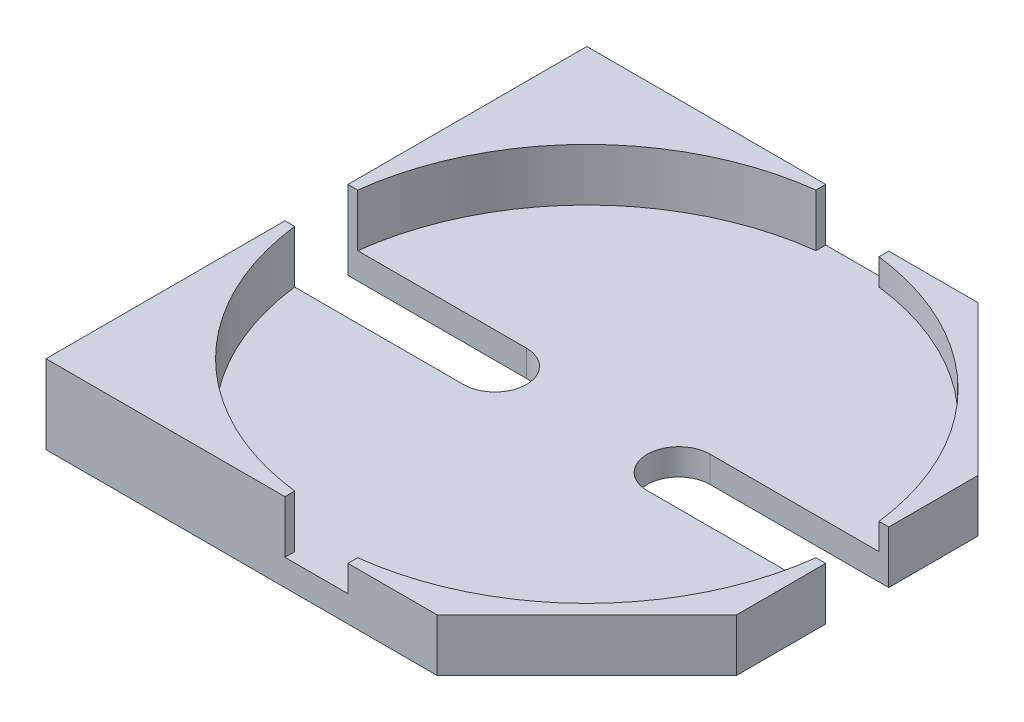
from build123d import *

# Parameters (mm, degrees)
BASE_DEPTH         = 0.5
BACK_HEIGHT_DEPTH  = 1
FRONT_HEIGHT_DEPTH = 0.5


with BuildPart() as part:
    # Sketch1 → Base (new body)
    with BuildSketch(Plane(origin=(0, 0, 0), x_dir=(1, 0, 0), z_dir=(0, 1, 0))):
        with BuildLine():
            Line((2.3, 5.15), (5.15, 2.3))
            Line((5.15, 2.3), (5.15, 0.6))
            Line((5.15, 0.6), (1.75, 0.6))
            ThreePointArc((1.75, 0.6), (1.15, 0), (1.75, -0.6))
            Line((1.75, -0.6), (5.15, -0.6))
            Line((5.15, -0.6), (5.15, -2.3))
            Line((5.15, -2.3), (2.3, -5.15))
            Line((2.3, -5.15), (-5.15, -5.15))
            Line((-5.15, -5.15), (-5.15, -0.6))
            Line((-5.15, -0.6), (-1.75, -0.6))
            ThreePointArc((-1.75, -0.6), (-1.15, 0), (-1.75, 0.6))
            Line((-1.75, 0.6), (-5.15, 0.6))
            Line((-5.15, 0.6), (-5.15, 5.15))
            Line((-5.15, 5.15), (2.3, 5.15))
        make_face()
    extrude(amount=BASE_DEPTH)

    # Sketch2 → Back Height (add)
    with BuildSketch(Plane(origin=(0, 0.5, 0), x_dir=(1, 0, 0), z_dir=(0, 1, 0))):
        with BuildLine():
            Line((-0.6, 4.963869458), (-0.6, 5.15))
            Line((-0.6, 5.15), (-5.15, 5.15))
            Line((-5.15, 5.15), (-5.15, 0.6))
            Line((-5.15, 0.6), (-4.963869458, 0.6))
            ThreePointArc((-4.963869458, 0.6), (-3.535533906, 3.535533906), (-0.6, 4.963869458))
        make_face()
        with BuildLine():
            ThreePointArc((-0.6, -4.963869458), (-3.535533906, -3.535533906), (-4.963869458, -0.6))
            Line((-4.963869458, -0.6), (-5.15, -0.6))
            Line((-5.15, -0.6), (-5.15, -5.15))
            Line((-5.15, -5.15), (-0.6, -5.15))
            Line((-0.6, -5.15), (-0.6, -4.963869458))
        make_face()
    extrude(amount=BACK_HEIGHT_DEPTH)

    # Sketch2<3> → Front Height (add)
    with BuildSketch(Plane(origin=(0, 0.5, 0), x_dir=(1, 0, 0), z_dir=(0, 1, 0))):
        with BuildLine():
            Line((2.3, 5.15), (0.6, 5.15))
            Line((0.6, 5.15), (0.6, 4.963869458))
            ThreePointArc((0.6, 4.963869458), (3.535533906, 3.535533906), (4.963869458, 0.6))
            Line((4.963869458, 0.6), (5.15, 0.6))
            Line((5.15, 0.6), (5.15, 2.3))
            Line((5.15, 2.3), (2.3, 5.15))
        make_face()
        with BuildLine():
            Line((5.15, -0.6), (4.963869458, -0.6))
            ThreePointArc((4.963869458, -0.6), (3.535533906, -3.535533906), (0.6, -4.963869458))
            Line((0.6, -4.963869458), (0.6, -5.15))
            Line((0.6, -5.15), (2.3, -5.15))
            Line((2.3, -5.15), (5.15, -2.3))
            Line((5.15, -2.3), (5.15, -0.6))
        make_face()
    extrude(amount=FRONT_HEIGHT_DEPTH)


solid = part.part
